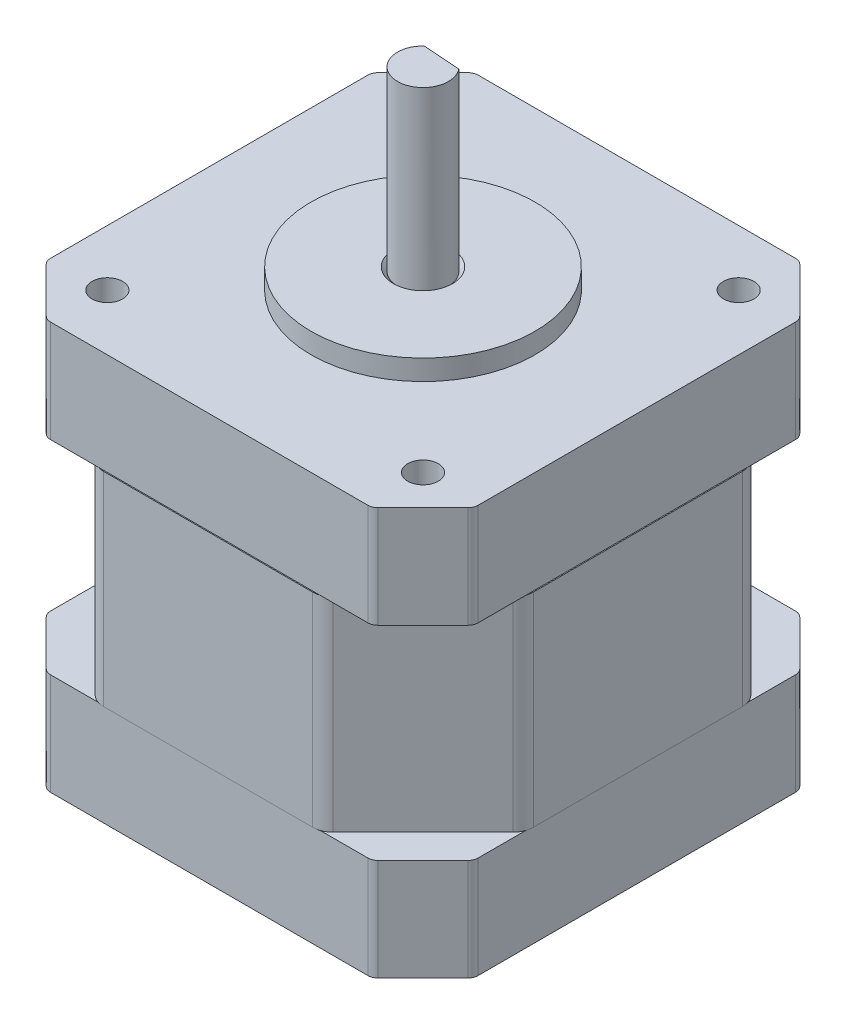
from build123d import *

# Parameters (mm, degrees)
BOSS_EXTRUDE1_DEPTH = 10
BOSS_EXTRUDE2_DEPTH = 10
MIRROR1_START       = 20
MIRROR1_DEPTH       = 20
MIRROR1_START_2     = 30
MIRROR1_2_DEPTH     = 10
MIRROR1_3_DEPTH     = 10
FILLET1_R           = 2
FILLET2_R           = 1
SKETCH3_R           = 11
BOSS_EXTRUDE3_DEPTH = 2
SKETCH4_R           = 1.5
CUT_EXTRUDE1_DEPTH  = 4.5
SKETCH5_R           = 2.5
CUT_EXTRUDE3_DEPTH  = 52.521063654
CHAMFER3_SIZE       = 0.4
BOSS_EXTRUDE4_START = -59
SKETCH6_R           = 2.5
BOSS_EXTRUDE4_DEPTH = 59
CUT_EXTRUDE8_DEPTH  = 17


# Read off the part's stored shape, not the designer's step: Mirror1
with BuildPart() as part:
    # Sketch1 → Boss-Extrude1 (new body)
    with BuildSketch(Plane(origin=(0, 0, 0), x_dir=(1, 0, 0), z_dir=(0, 1, 0))):
        Polygon((-21, 16), (-16, 21), (16, 21), (21, 16), (21, -16), (16, -21), (-16, -21), (-21, -16), align=None)
    extrude(amount=BOSS_EXTRUDE1_DEPTH)

    # Sketch2 → Boss-Extrude2 (add)
    with BuildSketch(Plane(origin=(0, 10, 0), x_dir=(1, 0, 0), z_dir=(0, 1, 0))):
        Polygon((-21.1, 11.1), (-11.1, 21.1), (11.1, 21.1), (21.1, 11.1), (21.1, -11.1), (11.1, -21.1), (-11.1, -21.1), (-21.1, -11.1), align=None)
    extrude(amount=BOSS_EXTRUDE2_DEPTH)

    # Mirror1 outline → Mirror1 (add)
    with BuildSketch(Plane(origin=(0, 0, 0), x_dir=(1, 0, 0), z_dir=(0, 1, 0)).offset(MIRROR1_START)):
        Polygon((-21, 11.2), (-21, -11.2), (-11.2, -21), (11.2, -21), (21, -11.2), (21, 11.2), (11.2, 21), (-11.2, 21), align=None)
    extrude(amount=MIRROR1_DEPTH)

    # Mirror1 2 outline → Mirror1 2 (add)
    with BuildSketch(Plane(origin=(0, 0, 0), x_dir=(1, 0, 0), z_dir=(0, 1, 0)).offset(MIRROR1_START_2)):
        Polygon((-21, -11.2), (-21, -16), (-16, -21), (-11.2, -21), align=None)
        Polygon((-21, 16), (-21, 11.2), (-11.2, 21), (-16, 21), align=None)
        Polygon((21, -11.2), (11.2, -21), (16, -21), (21, -16), align=None)
        Polygon((16, 21), (11.2, 21), (21, 11.2), (21, 16), align=None)
    extrude(amount=MIRROR1_2_DEPTH)

    # Mirror1 3 outline → Mirror1 3 (add)
    with BuildSketch(Plane(origin=(0, 0, 0), x_dir=(1, 0, 0), z_dir=(0, 1, 0)).offset(MIRROR1_START)):
        Polygon((-21.1, -11.1), (-21, -11.2), (-21, 11.2), (-21.1, 11.1), align=None)
        Polygon((11.2, -21), (-11.2, -21), (-11.1, -21.1), (11.1, -21.1), align=None)
        Polygon((-11.1, 21.1), (-11.2, 21), (11.2, 21), (11.1, 21.1), align=None)
        Polygon((21, 11.2), (21, -11.2), (21.1, -11.1), (21.1, 11.1), align=None)
    extrude(amount=MIRROR1_3_DEPTH)

    # Fillet1
    # the kernel refuses this fillet: 2 mm, written as the material it takes off along each edge
    with BuildSketch(Plane(origin=(11.1, 10, -21.1), x_dir=(0.7071067811865497, 0, 0.7071067811865454), z_dir=(0, 1, 0)), Plane(origin=(-11.1, 30, -21.1), x_dir=(-0.707106781186553, 0, 0.7071067811865422), z_dir=(0, -1, 0)), Plane(origin=(-21.1, 10, -11.1), x_dir=(0.7071067811865487, 0, -0.7071067811865465), z_dir=(0, 1, 0)), Plane(origin=(-21.1, 30, 11.1), x_dir=(0.7071067811865239, 1.1932702685997172e-15, 0.7071067811865711), z_dir=(0, -1, 0)), Plane(origin=(-11.1, 10, 21.1), x_dir=(-0.7071067811865497, 0, -0.7071067811865454), z_dir=(0, 1, 0)), Plane(origin=(21.1, 30, -11.1), x_dir=(-0.7071067811865326, 1.3816813636417406e-15, -0.7071067811865626), z_dir=(0, -1, 0))) as fillet1_piece_1:
        with BuildLine():
            CenterArc((FILLET1_R * 0.414213562373, -FILLET1_R), FILLET1_R, 90, 45)
            Line((-FILLET1_R * 0.292893218813, -FILLET1_R * 0.292893218813), (0, 0))
            Line((0, 0), (FILLET1_R * 0.414213562373, 0))
        make_face()
    extrude(amount=20, mode=Mode.SUBTRACT)
    with BuildSketch(Plane(origin=(11.1, 10, 21.1), x_dir=(0.7071067811865465, 0, -0.7071067811865487), z_dir=(0, 1, 0)), Plane(origin=(21.1, 30, 11.1), x_dir=(-0.7071067811865475, 0, 0.7071067811865475), z_dir=(0, -1, 0))) as fillet1_piece_2:
        with BuildLine():
            CenterArc((FILLET1_R * 0.414213562373, FILLET1_R), FILLET1_R, 225, 45)
            Line((-FILLET1_R * 0.292893218813, FILLET1_R * 0.292893218813), (0, 0))
            Line((0, 0), (FILLET1_R * 0.414213562373, 0))
        make_face()
    extrude(amount=20, mode=Mode.SUBTRACT)

    # Fillet2
    fillet2_edges = [part.edges().sort_by_distance(p)[0] for p in [
        (-21, 5, -16),
        (-16, 5, -21),
        (16, 5, -21),
        (21, 5, -16),
        (21, 5, 16),
        (16, 5, 21),
        (-16, 5, 21),
        (-21, 5, 16),
        (-21, 35, 16),
        (-16, 35, 21),
        (16, 35, 21),
        (21, 35, 16),
        (21, 35, -16),
        (16, 35, -21),
        (-16, 35, -21),
        (-21, 35, -16),
    ]]
    fillet(fillet2_edges, radius=FILLET2_R)

    # Sketch3 → Boss-Extrude3 (add)
    with BuildSketch(Plane(origin=(0, 40, 0), x_dir=(1, 0, 0), z_dir=(0, 1, 0))):
        with Locations(Location((0, 0, 0), (0, 0, 270))):
            Circle(SKETCH3_R)
    extrude(amount=BOSS_EXTRUDE3_DEPTH)

    # Sketch4 → Cut-Extrude1 (cut)
    with BuildSketch(Plane(origin=(0, 40, 0), x_dir=(1, 0, 0), z_dir=(0, 1, 0))):
        with Locations(Location((-15.5, 15.5, 0), (0, 0, 270))):
            Circle(SKETCH4_R)
        with Locations(Location((15.5, 15.5, 0), (0, 0, 270))):
            Circle(SKETCH4_R)
        with Locations(Location((15.5, -15.5, 0), (0, 0, 270))):
            Circle(SKETCH4_R)
        with Locations(Location((-15.5, -15.5, 0), (0, 0, 270))):
            Circle(SKETCH4_R)
    extrude(amount=-CUT_EXTRUDE1_DEPTH, mode=Mode.SUBTRACT)

    # Sketch5 → Cut-Extrude3 (cut, through all)
    with BuildSketch(Plane(origin=(0, 42, 0), x_dir=(1, 0, 0), z_dir=(0, 1, 0))):
        with Locations(Location((0, 0, 0), (0, 0, 270))):
            Circle(SKETCH5_R)
    extrude(amount=-CUT_EXTRUDE3_DEPTH, mode=Mode.SUBTRACT)

    # Chamfer3
    chamfer3_edges = [part.edges().sort_by_distance(p)[0] for p in [
        (0, 42, -2.5),
    ]]
    chamfer(chamfer3_edges, length=CHAMFER3_SIZE)

    # Sketch6 → Boss-Extrude4 (add)
    with BuildSketch(Plane.XZ.offset(BOSS_EXTRUDE4_START)):
        with Locations(Location((0, 0, 0), (0, 0, 90))):
            Circle(SKETCH6_R)
    extrude(amount=BOSS_EXTRUDE4_DEPTH)

    # Sketch7 → Cut-Extrude8 (cut)
    with BuildSketch(Plane(origin=(0, 59, 0), x_dir=(1, 0, 0), z_dir=(0, 1, 0))):
        with BuildLine():
            Line((1.947589111, 1.567449092), (-1.709469516, 1.824202284))
            ThreePointArc((-1.709469516, 1.824202284), (0.175087938, 2.493861306), (1.947589111, 1.567449092))
        make_face()
    extrude(amount=-CUT_EXTRUDE8_DEPTH, mode=Mode.SUBTRACT)


solid = part.part
